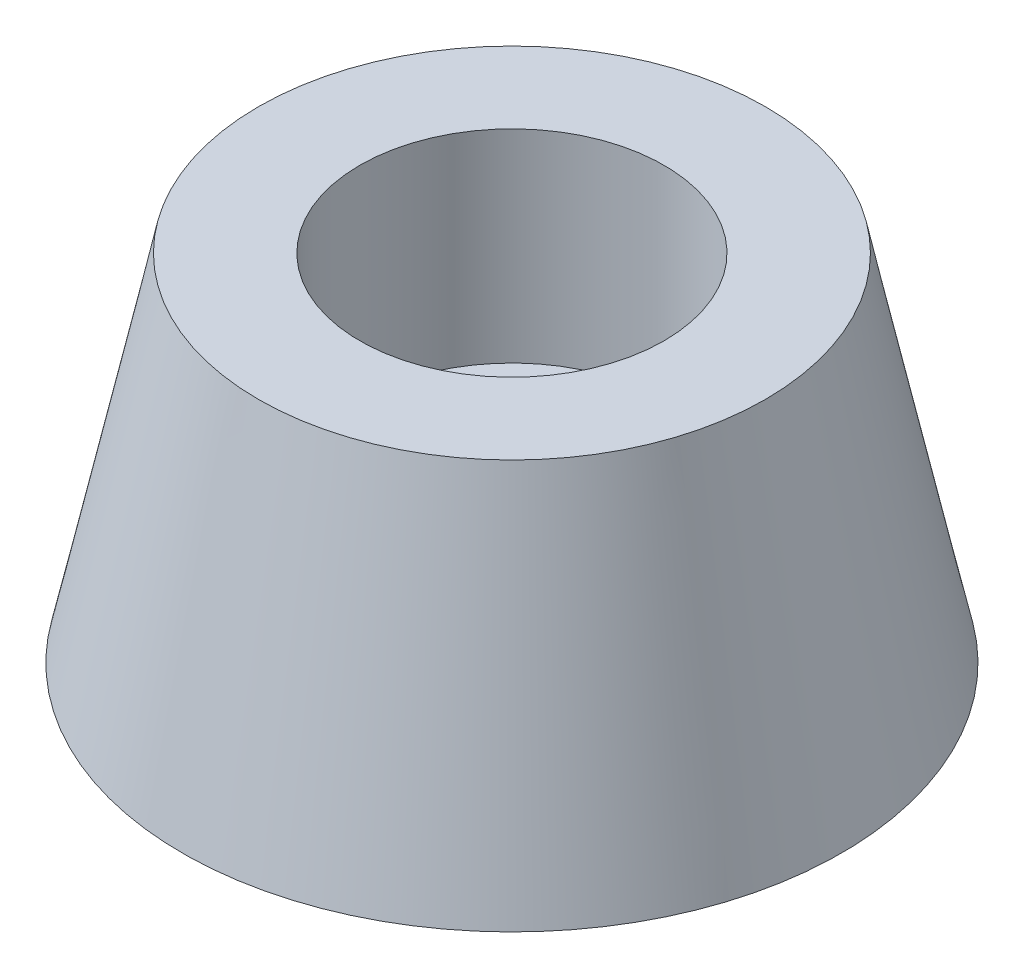
from build123d import *

# Parameters (mm, degrees)
SKETCH2_R          = 1.65
CUT_EXTRUDE1_DEPTH = 10
SKETCH3_R          = 3
CUT_EXTRUDE2_DEPTH = 4


with BuildPart() as part:
    # Sketch1 → Revolve1 (revolve)
    with BuildSketch(Plane.XY):
        Polygon((0, -7), (6.5, -7), (5, 0), (0, 0), align=None)
    revolve(axis=Axis((0, 0, 0), (0, -1, 0)))

    # Sketch2 → Cut-Extrude1 (cut)
    with BuildSketch(Plane(origin=(0, 0, 0), x_dir=(1, 0, 0), z_dir=(0, 1, 0))):
        Circle(SKETCH2_R)
    extrude(amount=-CUT_EXTRUDE1_DEPTH, mode=Mode.SUBTRACT)

    # Sketch3 → Cut-Extrude2 (cut)
    with BuildSketch(Plane(origin=(0, 0, 0), x_dir=(1, 0, 0), z_dir=(0, 1, 0))):
        Circle(SKETCH3_R)
    extrude(amount=-CUT_EXTRUDE2_DEPTH, mode=Mode.SUBTRACT)


solid = part.part
